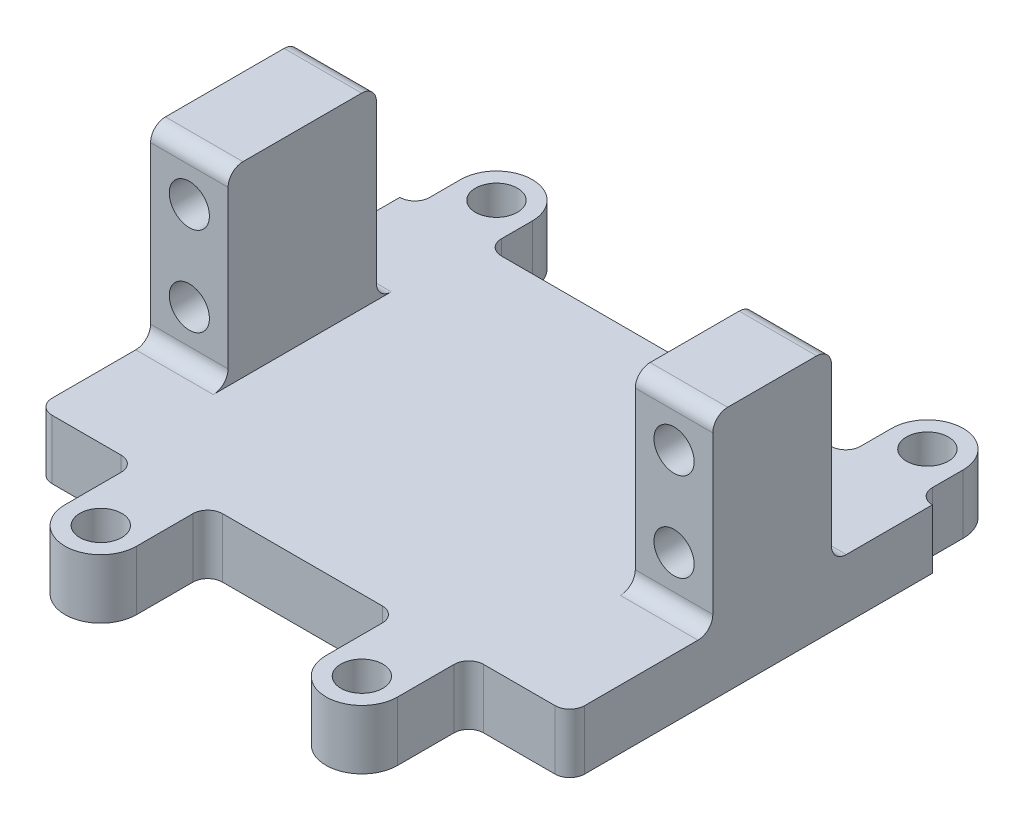
from build123d import *
from build123d.topology import SkipClean

# Parameters (mm, degrees)
SKETCH1_W           = 54.4
SKETCH1_H           = 38.8
BOSS_EXTRUDE1_DEPTH = 3.175
SKETCH2_W           = 7
SKETCH2_H           = 15.875
BOSS_EXTRUDE2_DEPTH = 20
SKETCH3_R           = 3.8354
SKETCH3_R_2         = 2.2479
BOSS_EXTRUDE3_DEPTH = 3.175
LPATTERN1_COUNT     = 2
LPATTERN1_PITCH     = 27.94
SKETCH6_R           = 3.8354
SKETCH6_R_2         = 2.2479
BOSS_EXTRUDE6_DEPTH = 3.175
SKETCH7_R           = 2.150000018
CUT_EXTRUDE1_DEPTH  = 15.875
BOSS_EXTRUDE7_DEPTH = 1.2948
SKETCH11_R          = 2.2479
BOSS_EXTRUDE8_DEPTH = 3.175
CUT_EXTRUDE2_REACH  = 79.746
SKETCH13_W          = 3.175
SKETCH13_H          = 20
FILLET1_R           = 1.5875


with BuildPart() as part:
    # Sketch1 → Boss-Extrude1 (new body)
    with BuildSketch(Plane(origin=(0, 0, 0), x_dir=(1, 0, 0), z_dir=(0, 1, 0))):
        with Locations((27.2, 19.4)):
            Rectangle(SKETCH1_W, SKETCH1_H)
    extrude(amount=BOSS_EXTRUDE1_DEPTH)

    # Sketch2 → Boss-Extrude2 (add)
    with BuildSketch(Plane(origin=(0, 3.175, 0), x_dir=(1, 0, 0), z_dir=(0, 1, 0))):
        with Locations((3.5, 20.0625)):
            Rectangle(SKETCH2_W, SKETCH2_H)
    boss_extrude2 = extrude(amount=BOSS_EXTRUDE2_DEPTH)

    # Mirror1: Boss-Extrude2 across plane
    add(boss_extrude2.mirror(Plane.ZY.offset(-27.2)))

    # Sketch3 → Boss-Extrude3 (add)
    # profile 1 of 2: a face of its own
    with BuildSketch(Plane(origin=(0, 3.175, 0), x_dir=(1, 0, 0), z_dir=(0, 1, 0))):
        with Locations((13.109999942, -7.608)):
            Circle(SKETCH3_R)
        with Locations(Location((13.109999942, -7.608, 0), (0, 0, 270))):
            Circle(SKETCH3_R_2, mode=Mode.SUBTRACT)
    # profile 2 of 2: a face of its own
    with BuildSketch(Plane(origin=(0, 3.175, 0), x_dir=(1, 0, 0), z_dir=(0, 1, 0))):
        with BuildLine():
            Line((9.274599942, 0), (9.274599942, -7.608))
            ThreePointArc((9.274599942, -7.608), (13.109999942, -3.7726), (16.945399942, -7.608))
            Line((16.945399942, -7.608), (16.945399942, 0))
            Line((16.945399942, 0), (9.274599942, 0))
        make_face()
    boss_extrude3 = extrude(amount=-BOSS_EXTRUDE3_DEPTH)

    # LPattern1: Boss-Extrude3 ×2
    with Locations(*[(i * LPATTERN1_PITCH, 0, 0) for i in range(1, LPATTERN1_COUNT)]):
        add(boss_extrude3)

    # Sketch6 → Boss-Extrude6 (add)
    # profile 1 of 2: a face of its own
    with BuildSketch(Plane(origin=(0, 3.175, 0), x_dir=(1, 0, 0), z_dir=(0, 1, 0))):
        with Locations((4.1402, 43.7)):
            Circle(SKETCH6_R)
        with Locations(Location((4.1402, 43.7, 0), (0, 0, 270))):
            Circle(SKETCH6_R_2, mode=Mode.SUBTRACT)
    # profile 2 of 2: a face of its own
    with BuildSketch(Plane(origin=(0, 3.175, 0), x_dir=(1, 0, 0), z_dir=(0, 1, 0))):
        with BuildLine():
            ThreePointArc((7.9756, 43.7), (4.1402, 39.8646), (0.3048, 43.7))
            Line((0.3048, 43.7), (0.3048, 38.8))
            Line((0.3048, 38.8), (7.9756, 38.8))
            Line((7.9756, 38.8), (7.9756, 43.7))
        make_face()
    boss_extrude6 = extrude(amount=-BOSS_EXTRUDE6_DEPTH)

    # Mirror3: Boss-Extrude6 across plane
    add(boss_extrude6.mirror(Plane.ZY.offset(-27.2)))

    # Sketch7 → Cut-Extrude1 (cut)
    with BuildSketch(Plane(origin=(0, 0, -28), x_dir=(-1, 0, 0), z_dir=(0, 0, -1))):
        with Locations((-2.852600116, 17.925)):
            Circle(SKETCH7_R)
        with Locations((-2.852600116, 8.425)):
            Circle(SKETCH7_R)
    cut_extrude1 = extrude(amount=-CUT_EXTRUDE1_DEPTH, mode=Mode.SUBTRACT)

    # Sketch9 → Boss-Extrude7 (add)
    with BuildSketch(Plane.ZY):
        Polygon((-38.8, 0), (-38.8, 3.175), (-28, 3.175), (-28, 23.175), (-12.125, 23.175), (-12.125, 3.175), (0, 3.175), (0, 0), align=None)
    boss_extrude7 = extrude(amount=BOSS_EXTRUDE7_DEPTH)

    # Mirror4: Boss-Extrude7 across plane
    add(boss_extrude7.mirror(Plane.ZY.offset(-27.2)))

    # Mirror5: Cut-Extrude1 across plane
    add(cut_extrude1.mirror(Plane.ZY.offset(-27.2)), mode=Mode.SUBTRACT)

    # Sketch11 → Boss-Extrude8 (add)
    with SkipClean():  # the faces are left unmerged after this step: merging them gives an invalid solid
        with BuildSketch(Plane.XZ):
            with BuildLine():
                Line((0.3048, -38.8), (0.3048, -43.7))
                ThreePointArc((0.3048, -43.7), (4.1402, -47.5354), (7.9756, -43.7))
                Line((7.9756, -43.7), (7.9756, -38.8))
                Line((7.9756, -38.8), (46.4244, -38.8))
                Line((46.4244, -38.8), (46.4244, -43.7))
                ThreePointArc((46.4244, -43.7), (50.2598, -47.5354), (54.0952, -43.7))
                Line((54.0952, -43.7), (54.0952, -38.8))
                Line((54.0952, -38.8), (55.6948, -38.8))
                Line((55.6948, -38.8), (55.6948, 0))
                Line((55.6948, 0), (44.885399942, 0))
                Line((44.885399942, 0), (44.885399942, 7.608))
                ThreePointArc((44.885399942, 7.608), (41.049999942, 11.4434), (37.214599942, 7.608))
                Line((37.214599942, 7.608), (37.214599942, 0))
                Line((37.214599942, 0), (16.945399942, 0))
                Line((16.945399942, 0), (16.945399942, 7.608))
                ThreePointArc((16.945399942, 7.608), (13.109999942, 11.4434), (9.274599942, 7.608))
                Line((9.274599942, 7.608), (9.274599942, 0))
                Line((9.274599942, 0), (-1.2948, 0))
                Line((-1.2948, 0), (-1.2948, -38.8))
                Line((-1.2948, -38.8), (0.3048, -38.8))
            make_face()
            with Locations(Location((4.1402, -43.7, 0), (0, 0, 90))):
                Circle(SKETCH11_R, mode=Mode.SUBTRACT)
            with Locations(Location((50.2598, -43.7, 0), (0, 0, 90))):
                Circle(SKETCH11_R, mode=Mode.SUBTRACT)
            with Locations(Location((41.049999942, 7.608, 0), (0, 0, 90))):
                Circle(SKETCH11_R, mode=Mode.SUBTRACT)
            with Locations(Location((13.109999942, 7.608, 0), (0, 0, 90))):
                Circle(SKETCH11_R, mode=Mode.SUBTRACT)
        extrude(amount=BOSS_EXTRUDE8_DEPTH)
    add(part.part.scale(1), mode=Mode.REPLACE)  # the faces are merged on a copy

    # Sketch13 → Cut-Extrude2 (cut, up to next)
    with BuildSketch(Plane(origin=(55.6948, 0, 0), x_dir=(0, 0, -1), z_dir=(1, 0, 0)), mode=Mode.PRIVATE) as cut_extrude2_sk1:
        with Locations((13.7125, 13.175)):
            Rectangle(SKETCH13_W, SKETCH13_H)
    cut_extrude2_tool1 = extrude(cut_extrude2_sk1.sketch, amount=-CUT_EXTRUDE2_REACH, mode=Mode.PRIVATE) & part.part
    add(cut_extrude2_tool1.solids().sort_by_distance((55.6948, 13.175, -13.7125))[0], mode=Mode.SUBTRACT)

    # Fillet1
    fillet1_edges = [part.edges().sort_by_distance(p)[0] for p in [
        (-1.2948, 0, 0),
        (55.6948, 0, 0),
        (2.8526, 3.175, -12.125),
        (2.8526, 3.175, -28),
        (2.8526, 23.175, -12.125),
        (2.8526, 23.175, -28),
        (51.5474, 23.175, -15.3),
        (51.5474, 3.175, -15.3),
        (51.5474, 23.175, -28),
        (51.5474, 3.175, -28),
        (16.945399942, 0, 0),
        (9.274599942, 0, 0),
        (44.885399942, 0, 0),
        (37.214599942, 0, 0),
        (0.3048, 0, -38.8),
        (7.9756, 0, -38.8),
        (46.4244, 0, -38.8),
        (54.0952, 0, -38.8),
    ]]
    fillet(fillet1_edges, radius=FILLET1_R)


solid = part.part
